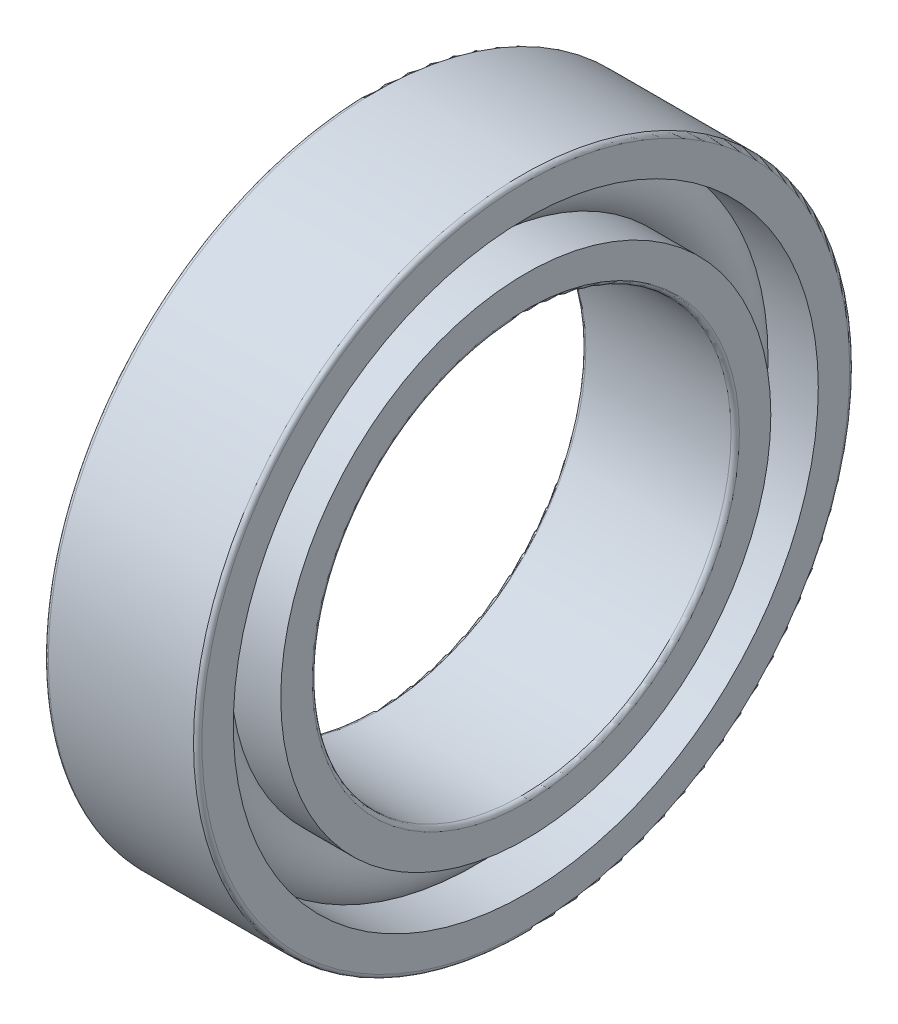
from build123d import *

# Parameters (mm, degrees)
CAGSPISKE_W     = 0.51
CAGSPISKE_H     = 0.85
CAGESPINE_ANGLE = 0.001
BALSIMSKE_R     = 2.55


with BuildPart() as part:
    # CagSpiSke → CageSpine (revolve)
    with BuildSketch(Plane.XY):
        with Locations((0, 19.25)):
            Rectangle(CAGSPISKE_W, CAGSPISKE_H)
    revolve(axis=Axis((-20.6375, 0, 0), (-1, 0, 0)), revolution_arc=CAGESPINE_ANGLE)

    # BalSimSke → BallsSimplified (revolve)
    with BuildSketch(Plane.XY):
        with Locations((0, 19.25)):
            Circle(BALSIMSKE_R)
    revolve(axis=Axis((-10, 0, 0), (1, 0, 0)))

    # InnRacSke → InnerRace (revolve)
    with BuildSketch(Plane.XY):
        with BuildLine():
            Line((-1.86698286, 17.55), (-5.5, 17.55))
            Line((-5.5, 17.55), (-5.5, 15.3))
            ThreePointArc((-5.5, 15.3), (-5.412132034, 15.087867966), (-5.2, 15))
            Line((-5.2, 15), (5.2, 15))
            ThreePointArc((5.2, 15), (5.412132034, 15.087867966), (5.5, 15.3))
            Line((5.5, 15.3), (5.5, 17.55))
            Line((5.5, 17.55), (1.86698286, 17.55))
            ThreePointArc((1.86698286, 17.55), (0, 16.725), (-1.86698286, 17.55))
        make_face()
    revolve(axis=Axis((-20.6375, 0, 0), (1, 0, 0)))

    # OutRacSke → OuterRace (revolve)
    with BuildSketch(Plane.XY):
        with BuildLine():
            Line((-1.86698286, 20.95), (-5.5, 20.95))
            Line((-5.5, 20.95), (-5.5, 23.2))
            ThreePointArc((-5.5, 23.2), (-5.412132034, 23.412132034), (-5.2, 23.5))
            Line((-5.2, 23.5), (5.2, 23.5))
            ThreePointArc((5.2, 23.5), (5.412132034, 23.412132034), (5.5, 23.2))
            Line((5.5, 23.2), (5.5, 20.95))
            Line((5.5, 20.95), (1.86698286, 20.95))
            ThreePointArc((1.86698286, 20.95), (0, 21.775), (-1.86698286, 20.95))
        make_face()
    revolve(axis=Axis((-20.6375, 0, 0), (1, 0, 0)))


solid = part.part
